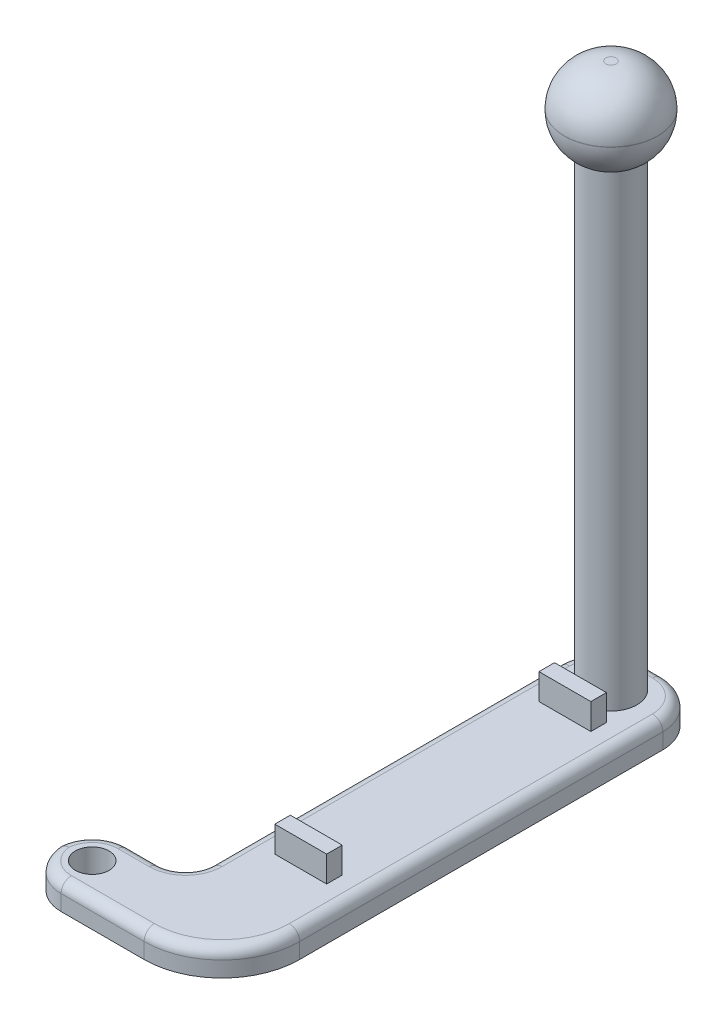
from build123d import *

# Parameters (mm, degrees)
SKETCH2_W           = 13
SKETCH2_H           = 13
SKETCH2_R           = 3.25
BOSS_EXTRUDE2_DEPTH = 5
FILLET1_R           = 15
FILLET2_R           = 5
FILLET3_R           = 7
FILLET4_R           = 2
FILLET5_R           = 8
SKETCH4_R           = 5
BOSS_EXTRUDE4_DEPTH = 90
SKETCH5_R           = 9
BOSS_EXTRUDE5_DEPTH = 15
FILLET6_R           = 8
SKETCH6_W           = 10
SKETCH6_H           = 1.5
BOSS_EXTRUDE6_DEPTH = 5
SKETCH7_W           = 10
SKETCH7_H           = 3
BOSS_EXTRUDE7_DEPTH = 5


with BuildPart() as part:
    # Sketch2 → Boss-Extrude2 (new body)
    # profile 1 of 2: a face of its own
    with BuildSketch(Plane(origin=(0, 0, 0), x_dir=(1, 0, 0), z_dir=(0, 1, 0))):
        with Locations((6.5, 6.5)):
            Rectangle(SKETCH2_W, SKETCH2_H)
        with Locations(Location((6.5, 6.5, 0), (0, 0, 270))):
            Circle(SKETCH2_R, mode=Mode.SUBTRACT)
    # profile 2 of 2: a face of its own
    with BuildSketch(Plane(origin=(0, 0, 0), x_dir=(1, 0, 0), z_dir=(0, 1, 0))):
        Polygon((13, 13), (13, 0), (38, 0), (38, 93), (18, 93), (18, 13), align=None)
    extrude(amount=BOSS_EXTRUDE2_DEPTH)

    # Fillet1
    fillet1_edges = [part.edges().sort_by_distance(p)[0] for p in [
        (38, 2.5, 0),
    ]]
    fillet(fillet1_edges, radius=FILLET1_R)

    # Fillet2
    fillet2_edges = [part.edges().sort_by_distance(p)[0] for p in [
        (18, 2.5, -13),
    ]]
    fillet(fillet2_edges, radius=FILLET2_R)

    # Fillet3
    # the kernel refuses this fillet: 7 mm, written as the material it takes off along each edge
    with BuildSketch(Plane(origin=(0, -17.5, 0), x_dir=(0, 0, -1), z_dir=(0, 1, 0)), Plane(origin=(0, -17.5, -13), x_dir=(1, 0, 0), z_dir=(0, 1, 0))) as fillet3_piece_1:
        with BuildLine():
            CenterArc((FILLET3_R, -FILLET3_R), FILLET3_R, 90, 90)
            Line((0, -FILLET3_R), (0, 0))
            Line((0, 0), (FILLET3_R, 0))
        make_face()
    extrude(amount=40, mode=Mode.SUBTRACT)

    # Fillet4
    # the kernel refuses this fillet: 2 mm, written as the material it takes off along each edge
    with BuildSketch(Plane(origin=(43, 5, -93), x_dir=(0, 0, 1), z_dir=(-1, 0, 0))) as fillet4_piece_1:
        with BuildLine():
            CenterArc((FILLET4_R, -FILLET4_R), FILLET4_R, 90, 90)
            Line((0, -FILLET4_R), (0, 0))
            Line((0, 0), (FILLET4_R, 0))
        make_face()
    extrude(amount=30, mode=Mode.SUBTRACT)
    with BuildSketch(Plane(origin=(18, 5, -98), x_dir=(1, 0, 0), z_dir=(0, 0, 1))) as fillet4_piece_2:
        with BuildLine():
            CenterArc((FILLET4_R, -FILLET4_R), FILLET4_R, 90, 90)
            Line((0, -FILLET4_R), (0, 0))
            Line((0, 0), (FILLET4_R, 0))
        make_face()
    extrude(amount=80, mode=Mode.SUBTRACT)
    with BuildSketch(Plane(origin=(38, 5, -15), x_dir=(-1, 0, 0), z_dir=(0, 0, -1))) as fillet4_piece_3:
        with BuildLine():
            CenterArc((FILLET4_R, -FILLET4_R), FILLET4_R, 90, 90)
            Line((0, -FILLET4_R), (0, 0))
            Line((0, 0), (FILLET4_R, 0))
        make_face()
    extrude(amount=83, mode=Mode.SUBTRACT)
    with BuildSketch(Plane(origin=(23, 5, -15), x_dir=(1, 0, 0), z_dir=(0, 0, -1))) as fillet4_piece_4:
        with BuildLine():
            CenterArc((15 - FILLET4_R, FILLET4_R), FILLET4_R, 270, 90)
            Line((15, FILLET4_R), (15, 0))
            Line((15, 0), (15 - FILLET4_R, 0))
        make_face()
    revolve(axis=Axis((23, 5, -15), (0, -1, 0)), revolution_arc=90, mode=Mode.SUBTRACT)
    with BuildSketch(Plane(origin=(13, 5, -18), x_dir=(0, 0, 1), z_dir=(-1, 0, 0))) as fillet4_piece_5:
        with BuildLine():
            CenterArc((5 + FILLET4_R, -FILLET4_R), FILLET4_R, 90, 90)
            Line((5, -FILLET4_R), (5, 0))
            Line((5, 0), (5 + FILLET4_R, 0))
        make_face()
    revolve(axis=Axis((13, 5, -18), (0, 1, 0)), revolution_arc=90, mode=Mode.SUBTRACT)
    with BuildSketch(Plane(origin=(23, 5, 0), x_dir=(0, 0, -1), z_dir=(-1, 0, 0))) as fillet4_piece_6:
        with BuildLine():
            CenterArc((FILLET4_R, FILLET4_R), FILLET4_R, 180, 90)
            Line((0, FILLET4_R), (0, 0))
            Line((0, 0), (FILLET4_R, 0))
        make_face()
    extrude(amount=16, mode=Mode.SUBTRACT)
    with BuildSketch(Plane(origin=(7, 5, -13), x_dir=(0, 0, 1), z_dir=(1, 0, 0))) as fillet4_piece_7:
        with BuildLine():
            CenterArc((FILLET4_R, FILLET4_R), FILLET4_R, 180, 90)
            Line((0, FILLET4_R), (0, 0))
            Line((0, 0), (FILLET4_R, 0))
        make_face()
    extrude(amount=6, mode=Mode.SUBTRACT)
    with BuildSketch(Plane(origin=(7, 5, -6), x_dir=(-0.8002659852705738, 0, 0.5996451891067899), z_dir=(0.5996451891067899, 0, 0.8002659852705738))) as fillet4_piece_8:
        with BuildLine():
            CenterArc((7 - FILLET4_R, FILLET4_R), FILLET4_R, 270, 90)
            Line((7, FILLET4_R), (7, 0))
            Line((7, 0), (7 - FILLET4_R, 0))
        make_face()
    revolve(axis=Axis((7, 5, -6), (0, -1, 0)), revolution_arc=126.844490412, mode=Mode.SUBTRACT)
    with BuildSketch(Plane(origin=(7, 5, -7), x_dir=(0, 0, 1), z_dir=(1, 0, 0))) as fillet4_piece_9:
        with BuildLine():
            CenterArc((7 - FILLET4_R, FILLET4_R), FILLET4_R, 270, 90)
            Line((7, FILLET4_R), (7, 0))
            Line((7, 0), (7 - FILLET4_R, 0))
        make_face()
    revolve(axis=Axis((7, 5, -7), (0, -1, 0)), revolution_arc=126.844490412, mode=Mode.SUBTRACT)

    # Fillet5
    # the kernel refuses this fillet: 8 mm, written as the material it takes off along each edge
    with BuildSketch(Plane(origin=(26, 5, -85), x_dir=(0, 0, -1), z_dir=(1, 0, 0))) as fillet5_piece_1:
        with BuildLine():
            CenterArc((6, -2), 2, 0, 90)
            Line((8, -2), (8, 0))
            Line((8, 0), (6, 0))
        make_face()
    revolve(axis=Axis((26, 5, -85), (0, 1, 0)), revolution_arc=90, mode=Mode.SUBTRACT)
    with BuildSketch(Plane(origin=(30, 5, -85), x_dir=(1, 0, 0), z_dir=(0, 0, 1))) as fillet5_piece_2:
        with BuildLine():
            CenterArc((6, -2), 2, 0, 90)
            Line((8, -2), (8, 0))
            Line((8, 0), (6, 0))
        make_face()
    revolve(axis=Axis((30, 5, -85), (0, 1, 0)), revolution_arc=90, mode=Mode.SUBTRACT)
    with BuildSketch(Plane(origin=(38, -20, -93), x_dir=(-1, 0, 0), z_dir=(0, 1, 0)), Plane(origin=(18, -20, -93), x_dir=(0, 0, 1), z_dir=(0, 1, 0))) as fillet5_piece_3:
        with BuildLine():
            CenterArc((FILLET5_R, FILLET5_R), FILLET5_R, 180, 90)
            Line((0, FILLET5_R), (0, 0))
            Line((0, 0), (FILLET5_R, 0))
        make_face()
    extrude(amount=25, mode=Mode.SUBTRACT)

    # Sketch4 → Boss-Extrude4 (add)
    with BuildSketch(Plane(origin=(0, 5, 0), x_dir=(1, 0, 0), z_dir=(0, 1, 0))):
        with Locations(Location((28, 85, 0), (0, 0, 90))):
            Circle(SKETCH4_R)
    extrude(amount=BOSS_EXTRUDE4_DEPTH)

    # Sketch5 → Boss-Extrude5 (add)
    with BuildSketch(Plane(origin=(0, 95, 0), x_dir=(1, 0, 0), z_dir=(0, 1, 0))):
        with Locations(Location((28, 85, 0), (0, 0, 270))):
            Circle(SKETCH5_R)
    extrude(amount=BOSS_EXTRUDE5_DEPTH)

    # Fillet6
    # the kernel refuses this fillet: 8 mm, written as the material it takes off along each edge
    with BuildSketch(Plane(origin=(28, 95, -85), x_dir=(0, 0, 1), z_dir=(-1, 0, 0))) as fillet6_piece_1:
        with BuildLine():
            CenterArc((1, 6.92820323), FILLET6_R, 300, 60)
            Line((5, 0), (5.08, -0.138564065))
            ThreePointArc((5.08, -0.138564065), (7, -0.16), (9, -0.16))
            Line((9, -0.16), (9.16, 0))
            Line((9.16, 0), (9.16, 6.92820323))
            Line((9.16, 6.92820323), (9, 6.92820323))
        make_face()
    revolve(axis=Axis((28, 95, -85), (0, 1, 0)), mode=Mode.SUBTRACT)
    with BuildSketch(Plane(origin=(28, 110, -85), x_dir=(0, 0, 1), z_dir=(-1, 0, 0))) as fillet6_piece_2:
        with BuildLine():
            CenterArc((9 - FILLET6_R, -FILLET6_R), FILLET6_R, 0, 90)
            Line((9 - FILLET6_R, 0), (9 - FILLET6_R, FILLET6_R * 0.02))
            Line((9 - FILLET6_R, FILLET6_R * 0.02), (9 + FILLET6_R * 0.02, FILLET6_R * 0.02))
            Line((9 + FILLET6_R * 0.02, FILLET6_R * 0.02), (9 + FILLET6_R * 0.02, -FILLET6_R))
            Line((9 + FILLET6_R * 0.02, -FILLET6_R), (9, -FILLET6_R))
        make_face()
    revolve(axis=Axis((28, 110, -85), (0, 1, 0)), mode=Mode.SUBTRACT)

    # Sketch6 → Boss-Extrude6 (add)
    with BuildSketch(Plane(origin=(0, 5, 0), x_dir=(1, 0, 0), z_dir=(0, 1, 0))):
        with Locations((28, 25.944405325)):
            Rectangle(SKETCH6_W, SKETCH6_H)
        with Locations((28, 27.444405325)):
            Rectangle(SKETCH6_W, SKETCH6_H)
    extrude(amount=BOSS_EXTRUDE6_DEPTH)

    # Sketch7 → Boss-Extrude7 (add)
    with BuildSketch(Plane(origin=(0, 5, 0), x_dir=(1, 0, 0), z_dir=(0, 1, 0))):
        with Locations((28, 77.6172361)):
            Rectangle(SKETCH7_W, SKETCH7_H)
    extrude(amount=BOSS_EXTRUDE7_DEPTH)


solid = part.part
